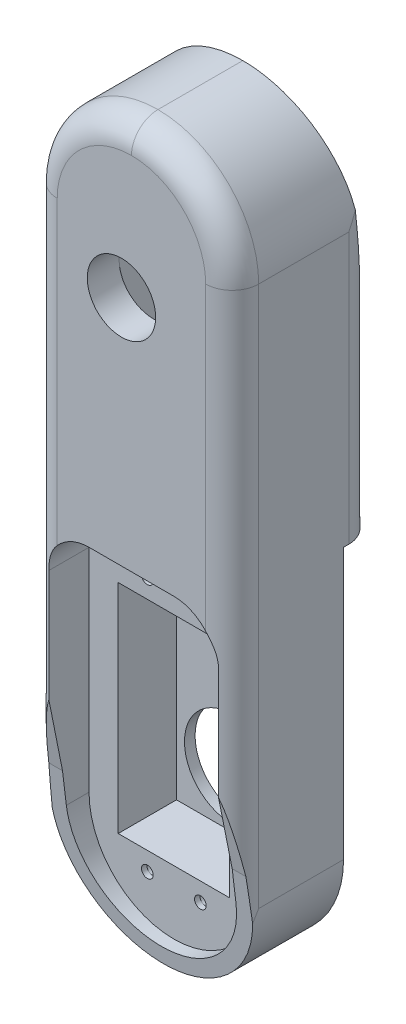
from build123d import *

# Parameters (mm, degrees)
SKETCH1_W               = 38
SKETCH1_H               = 120
SKETCH1_W_2             = 21
SKETCH1_H_2             = 41
BOSS_EXTRUDE1_DEPTH     = 11
SKETCH3_R               = 1.3
CUT_EXTRUDE1_DEPTH      = 8
FILLET3_R               = 19
BOSS_EXTRUDE2_DEPTH     = 8
CUT_EXTRUDE2_DEPTH      = 66.741919656
CUT_EXTRUDE2_DEPTH_BACK = 66.741919656
SKETCH7_W               = 32
SKETCH7_H               = 50
BOSS_EXTRUDE4_DEPTH     = 8
SKETCH8_W               = 38
SKETCH8_H               = 50
BOSS_EXTRUDE5_DEPTH     = 8
BOSS_EXTRUDE10_START    = 2
SKETCH27_R              = 9
BOSS_EXTRUDE10_DEPTH    = 2
SKETCH28_W              = 38
SKETCH28_H              = 27
BOSS_EXTRUDE11_DEPTH    = 20
FILLET4_R               = 19
CUT_EXTRUDE14_DEPTH     = 8
CUT_EXTRUDE18_DEPTH     = 91.581455056
FILLET7_R               = 5
SKETCH35_R              = 1.1
CUT_EXTRUDE20_DEPTH     = 8
FILLET8_R               = 8
SKETCH36_R              = 6.45
CUT_EXTRUDE21_DEPTH     = 85.391942883
SKETCH30_W              = 13
SKETCH30_H              = 23
CUT_EXTRUDE22_DEPTH     = 13


# Some blends are built 0.0001 mm under size
with BuildPart() as part:
    # Sketch1 → Boss-Extrude1 (new body)
    with BuildSketch(Plane.XY):
        Rectangle(SKETCH1_W, SKETCH1_H)
        with Locations((0, -24.5)):
            Rectangle(SKETCH1_W_2, SKETCH1_H_2, mode=Mode.SUBTRACT)
    extrude(amount=BOSS_EXTRUDE1_DEPTH)

    # Sketch3 → Cut-Extrude1 (cut)
    with BuildSketch(Plane.XY.offset(10)):
        with Locations((-5, -0.5)):
            Circle(SKETCH3_R)
        with Locations((5, -0.5)):
            Circle(SKETCH3_R)
        with Locations((5, -48.5)):
            Circle(SKETCH3_R)
        with Locations((-5, -48.5)):
            Circle(SKETCH3_R)
    extrude(amount=-CUT_EXTRUDE1_DEPTH, mode=Mode.SUBTRACT)

    # Fillet3
    fillet3_edges = [part.edges().sort_by_distance(p)[0] for p in [
        (19, -60, 5.5),
        (-19, -60, 5.5),
    ]]
    fillet(fillet3_edges, radius=FILLET3_R - 0.0001)  # a hair under: the kernel refuses the full size

    # Sketch4 → Boss-Extrude2 (add)
    with BuildSketch(Plane.XY.offset(11)):
        with BuildLine():
            Line((19, -41), (19, 60))
            Line((19, 60), (-19, 60))
            Line((-19, 60), (-19, -41))
            ThreePointArc((-19, -41), (-13.435028843, -54.435028843), (0, -60))
            ThreePointArc((0, -60), (13.435028843, -54.435028843), (19, -41))
        make_face()
        with BuildLine():
            Line((16, -41), (16, 57))
            Line((16, 57), (-16, 57))
            Line((-16, 57), (-16, -41))
            ThreePointArc((-16, -41), (-11.313708499, -52.313708499), (0, -57))
            ThreePointArc((0, -57), (11.313708499, -52.313708499), (16, -41))
        make_face(mode=Mode.SUBTRACT)
    extrude(amount=BOSS_EXTRUDE2_DEPTH)

    # Sketch6 → Cut-Extrude2 (cut, two sides: drawn at the far end of the back side and taken through both)
    with BuildSketch(Plane(origin=(0, 0, 0), x_dir=(0, 0, -1), z_dir=(1, 0, 0)).offset(-CUT_EXTRUDE2_DEPTH_BACK)):
        Polygon((-13, -60), (-16, -35), (-19, -20), (-19, -60), align=None)
    extrude(amount=CUT_EXTRUDE2_DEPTH + CUT_EXTRUDE2_DEPTH_BACK, mode=Mode.SUBTRACT)

    # Sketch7 → Boss-Extrude4 (add)
    with BuildSketch(Plane.XY.offset(11)):
        with Locations((0, 32)):
            Rectangle(SKETCH7_W, SKETCH7_H)
    extrude(amount=BOSS_EXTRUDE4_DEPTH)

    # Sketch8 → Boss-Extrude5 (add)
    with BuildSketch(Plane(origin=(0, 0, 0), x_dir=(-1, 0, 0), z_dir=(0, 0, -1))):
        with Locations((0, 35)):
            Rectangle(SKETCH8_W, SKETCH8_H)
    extrude(amount=BOSS_EXTRUDE5_DEPTH)

    # Sketch27 → Boss-Extrude10 (add)
    with BuildSketch(Plane(origin=(0, 0, 0), x_dir=(-1, 0, 0), z_dir=(0, 0, -1)).offset(BOSS_EXTRUDE10_START)):
        with BuildLine():
            Line((19, -41), (19, 10))
            Line((19, 10), (-19, 10))
            Line((-19, 10), (-19, -41))
            ThreePointArc((-19, -41), (-13.435028843, -54.435028843), (0, -60))
            ThreePointArc((0, -60), (13.435028843, -54.435028843), (19, -41))
        make_face()
        with Locations((0, -34.75)):
            Circle(SKETCH27_R, mode=Mode.SUBTRACT)
    extrude(amount=-BOSS_EXTRUDE10_DEPTH)

    # Sketch28 → Boss-Extrude11 (add)
    with BuildSketch(Plane(origin=(0, 60, 0), x_dir=(1, 0, 0), z_dir=(0, 1, 0))):
        with Locations((0, -5.5)):
            Rectangle(SKETCH28_W, SKETCH28_H)
    extrude(amount=BOSS_EXTRUDE11_DEPTH)

    # Fillet4
    fillet4_edges = [part.edges().sort_by_distance(p)[0] for p in [
        (-19, 80, 5.5),
        (19, 80, 5.5),
    ]]
    fillet(fillet4_edges, radius=FILLET4_R - 0.0001)  # a hair under: the kernel refuses the full size

    # Sketch29 → Cut-Extrude14 (cut)
    with BuildSketch(Plane(origin=(0, 0, -8), x_dir=(-1, 0, 0), z_dir=(0, 0, -1))):
        with BuildLine():
            Line((16, 13), (16, 61))
            ThreePointArc((16, 61), (11.313708499, 72.313708499), (0, 77))
            ThreePointArc((0, 77), (-11.313708499, 72.313708499), (-16, 61))
            Line((-16, 61), (-16, 13))
            Line((-16, 13), (16, 13))
        make_face()
    extrude(amount=-CUT_EXTRUDE14_DEPTH, mode=Mode.SUBTRACT)

    # Sketch33 → Cut-Extrude18 (cut, through all)
    with BuildSketch(Plane(origin=(19, 0, 0), x_dir=(0, 0, -1), z_dir=(1, 0, 0))):
        Polygon((2, 80), (8, 40), (8, 80), align=None)
    extrude(amount=-CUT_EXTRUDE18_DEPTH, mode=Mode.SUBTRACT)

    # Fillet7
    # the kernel refuses this fillet: 5 mm, written as the material it takes off along each edge
    with BuildSketch(Plane(origin=(-19, 77.5, -8), x_dir=(0, 0, 1), z_dir=(0, -1, 0)), Plane(origin=(19, -2.5, -8), x_dir=(0, 0, 1), z_dir=(0, 1, 0))) as fillet7_piece_1:
        with BuildLine():
            CenterArc((FILLET7_R, -FILLET7_R), FILLET7_R, 90, 90)
            Line((0, -FILLET7_R), (0, 0))
            Line((0, 0), (FILLET7_R, 0))
        make_face()
    extrude(amount=80, mode=Mode.SUBTRACT)
    with BuildSketch(Plane(origin=(-19, -57.5, 19), x_dir=(1, 0, 0), z_dir=(0, 1, 0)), Plane(origin=(19, 61.0001, 19), x_dir=(-1, 0, 0), z_dir=(0, -1, 0))) as fillet7_piece_2:
        with BuildLine():
            CenterArc((FILLET7_R, FILLET7_R), FILLET7_R, 180, 90)
            Line((0, FILLET7_R), (0, 0))
            Line((0, 0), (FILLET7_R, 0))
        make_face()
    extrude(amount=118.5001, mode=Mode.SUBTRACT)
    with BuildSketch(Plane(origin=(0.0001, 61.0001, 19), x_dir=(0, 1, 0), z_dir=(-1, 0, 0))) as fillet7_piece_3:
        with BuildLine():
            CenterArc((18.9999 - FILLET7_R, FILLET7_R), FILLET7_R, 270, 90)
            Line((18.9999, FILLET7_R), (18.9999, 0))
            Line((18.9999, 0), (18.9999 - FILLET7_R, 0))
        make_face()
    revolve(axis=Axis((0.0001, 61.0001, 19), (0, 0, -1)), revolution_arc=90, mode=Mode.SUBTRACT)
    with BuildSketch(Plane(origin=(-0.0001, 61.0001, 19), x_dir=(0, 1, 0), z_dir=(1, 0, 0))) as fillet7_piece_4:
        with BuildLine():
            CenterArc((18.9999 - FILLET7_R, -FILLET7_R), FILLET7_R, 0, 90)
            Line((18.9999, -FILLET7_R), (18.9999, 0))
            Line((18.9999, 0), (18.9999 - FILLET7_R, 0))
        make_face()
    revolve(axis=Axis((-0.0001, 61.0001, 19), (0, 0, 1)), revolution_arc=90, mode=Mode.SUBTRACT)
    with BuildSketch(Plane(origin=(-0.0001, 80, 19), x_dir=(0, -1, 0), z_dir=(1, 0, 0))) as fillet7_piece_5:
        with BuildLine():
            CenterArc((FILLET7_R, FILLET7_R), FILLET7_R, 180, 90)
            Line((0, FILLET7_R), (0, 0))
            Line((0, 0), (FILLET7_R, 0))
        make_face()
    extrude(amount=0.0002, mode=Mode.SUBTRACT)

    # Sketch35 → Cut-Extrude20 (cut)
    with BuildSketch(Plane.XY.offset(11)):
        with Locations((-5, -0.5)):
            Circle(SKETCH35_R)
        with Locations((5, -0.5)):
            Circle(SKETCH35_R)
        with Locations((5, -48.5)):
            Circle(SKETCH35_R)
        with Locations((-5, -48.5)):
            Circle(SKETCH35_R)
    extrude(amount=-CUT_EXTRUDE20_DEPTH, mode=Mode.SUBTRACT)

    # Fillet8
    fillet8_edges = [part.edges().sort_by_distance(p)[0] for p in [
        (-16, 7, 14.791287847),
        (16, 7, 14.791287847),
        (16, 13, -3.791287847),
        (-16, 13, -3.791287847),
    ]]
    fillet(fillet8_edges, radius=FILLET8_R)

    # Sketch36 → Cut-Extrude21 (cut, through all)
    with BuildSketch(Plane(origin=(0, 0, 0), x_dir=(-1, 0, 0), z_dir=(0, 0, -1))):
        with Locations((1.882410705, 50.832111393)):
            Circle(SKETCH36_R)
    extrude(amount=-CUT_EXTRUDE21_DEPTH, mode=Mode.SUBTRACT)

    # Sketch30 → Cut-Extrude22 (cut)
    with BuildSketch(Plane(origin=(0, 0, 0), x_dir=(-1, 0, 0), z_dir=(0, 0, -1))):
        with Locations((1.882410705, 46)):
            Rectangle(SKETCH30_W, SKETCH30_H)
    extrude(amount=-CUT_EXTRUDE22_DEPTH, mode=Mode.SUBTRACT)


solid = part.part
